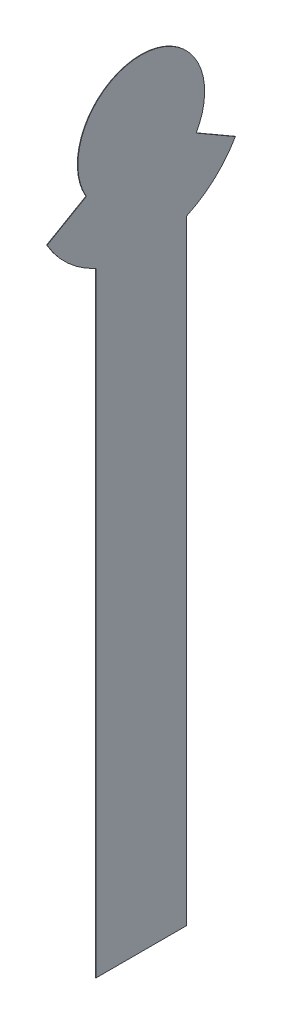
from build123d import *

# Parameters (mm, degrees)
BOSS_EXTRUDE1_DEPTH = 0.25


with BuildPart() as part:
    # Sketch1 → Boss-Extrude1 (new body)
    with BuildSketch(Plane(origin=(0, 0, 0), x_dir=(0, 0, -1), z_dir=(1, 0, 0))):
        with BuildLine():
            Line((-25, -54.543560573), (-25, -393.6))
            Line((-25, -393.6), (25, -393.6))
            Line((25, -393.6), (25, -54.543560573))
            ThreePointArc((25, -54.543560573), (40.390167668, -44.369295191), (51.961524227, -30))
            Line((51.961524227, -30), (30.310889132, -17.5))
            ThreePointArc((30.310889132, -17.5), (0, 35), (-30.310889132, -17.5))
            Line((-30.310889132, -17.5), (-51.961524227, -30))
            ThreePointArc((-51.961524227, -30), (-40.390167668, -44.369295191), (-25, -54.543560573))
        make_face()
    extrude(amount=-BOSS_EXTRUDE1_DEPTH)


solid = part.part
